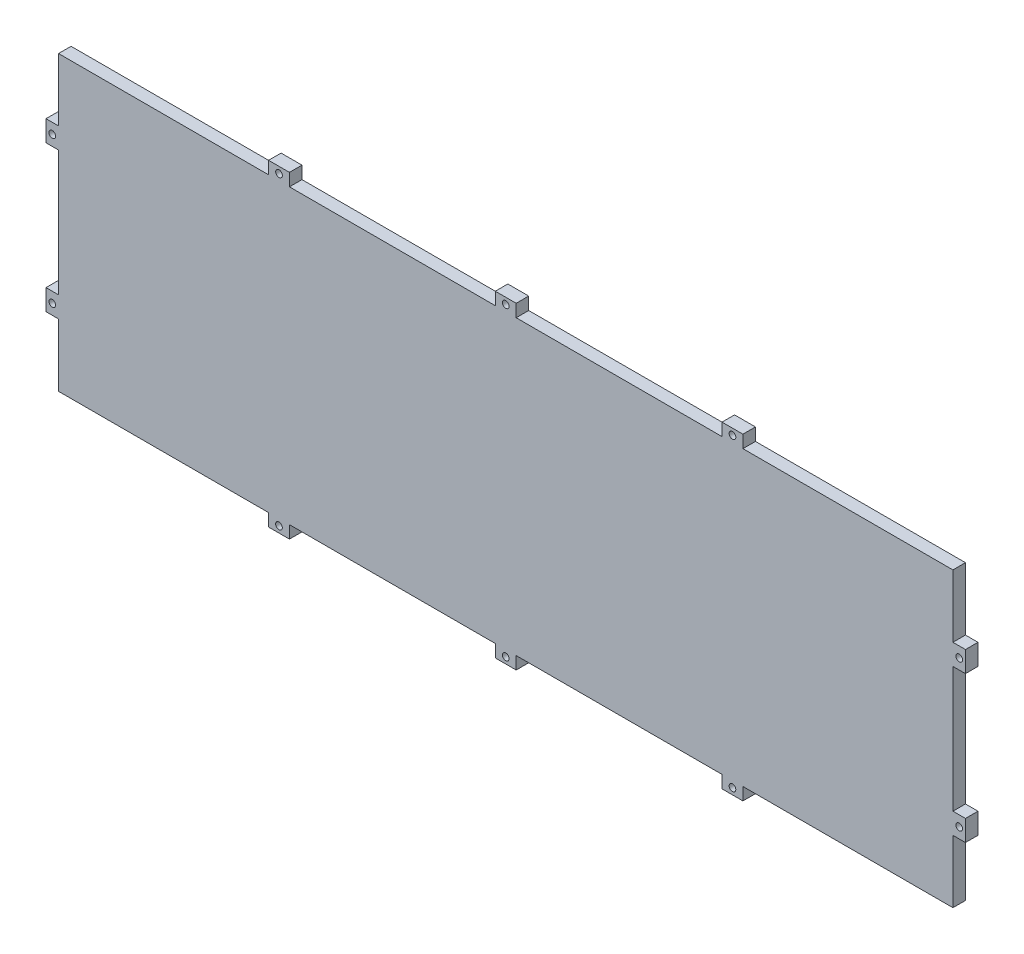
from build123d import *

# Parameters (mm, degrees)
SKETCH1_R           = 1.6
BOSS_EXTRUDE1_DEPTH = 6


with BuildPart() as part:
    # Sketch1 → Boss-Extrude1 (new body)
    with BuildSketch(Plane.XY):
        Polygon((6, 250), (106.5, 250), (106.5, 256), (116.5, 256), (116.5, 250), (215, 250), (215, 256), (225, 256), (225, 250), (323.5, 250), (323.5, 256), (333.5, 256), (333.5, 250), (434, 250), (434, 220), (440, 220), (440, 210), (434, 210), (434, 150), (440, 150), (440, 140), (434, 140), (434, 110), (333.5, 110), (333.5, 104), (323.5, 104), (323.5, 110), (225, 110), (225, 104), (215, 104), (215, 110), (116.5, 110), (116.5, 104), (106.5, 104), (106.5, 110), (6, 110), (6, 140), (0, 140), (0, 150), (6, 150), (6, 210), (0, 210), (0, 220), (6, 220), align=None)
        with Locations((111.5, 107)):
            Circle(SKETCH1_R, mode=Mode.SUBTRACT)
        with Locations((220, 107)):
            Circle(SKETCH1_R, mode=Mode.SUBTRACT)
        with Locations((328.5, 107)):
            Circle(SKETCH1_R, mode=Mode.SUBTRACT)
        with Locations((328.5, 253)):
            Circle(SKETCH1_R, mode=Mode.SUBTRACT)
        with Locations((220, 253)):
            Circle(SKETCH1_R, mode=Mode.SUBTRACT)
        with Locations((111.5, 253)):
            Circle(SKETCH1_R, mode=Mode.SUBTRACT)
        with Locations((3, 215)):
            Circle(SKETCH1_R, mode=Mode.SUBTRACT)
        with Locations((3, 145)):
            Circle(SKETCH1_R, mode=Mode.SUBTRACT)
        with Locations((437, 215)):
            Circle(SKETCH1_R, mode=Mode.SUBTRACT)
        with Locations((437, 145)):
            Circle(SKETCH1_R, mode=Mode.SUBTRACT)
    extrude(amount=-BOSS_EXTRUDE1_DEPTH)


solid = part.part
